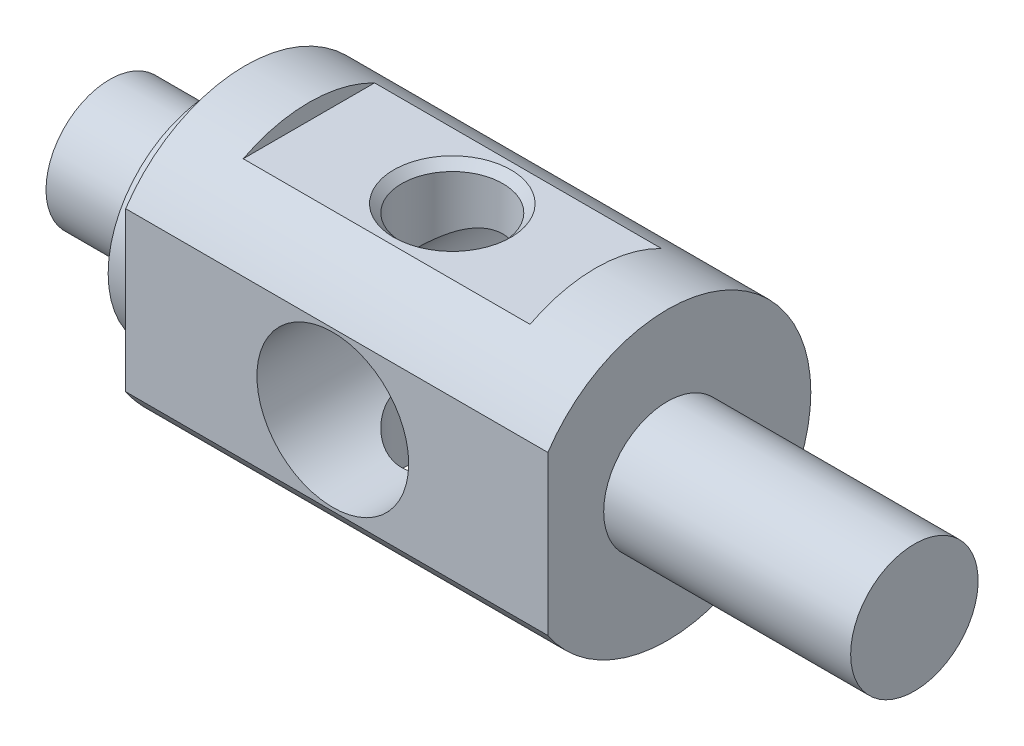
from build123d import *

# Parameters (mm, degrees)
SKETCH2_W                  = 30
SKETCH2_H                  = 12.7
CUT_EXTRUDE1_DEPTH         = 1.5
F_8_32_TAPPED_HOLE1_D      = 3.4544
F_8_32_TAPPED_HOLE1_DEPTH  = 10.71
F_8_32_TAPPED_HOLE1_TIP    = 1.037806461
SKETCH7_OUTSIDE_W          = 29.718
SKETCH7_OUTSIDE_H          = 31.218
SKETCH7_OUTSIDE_R          = 6.6
CUT_EXTRUDE2_DEPTH         = 2
F_3_8_0_3750_DOWEL_HOLE2_D = 9.525
CUT_EXTRUDE4_START         = 9
SKETCH11_W                 = 18
SKETCH11_H                 = 20
CUT_EXTRUDE4_DEPTH         = 1
F_1_4_0_2500_DOWEL_HOLE1_D = 6.35
CHAMFER1_SIZE              = 0.5


with BuildPart() as part:
    # Sketch1 → Revolve1 (revolve)
    with BuildSketch(Plane(origin=(0, 0, 0), x_dir=(1, 0, 0), z_dir=(0, 1, 0))):
        Polygon((-21.5, 0), (29, 0), (29, 4), (13.5, 4), (13.5, 9), (-15, 9), (-15, 4), (-21.5, 4), align=None)
    revolve(axis=Axis((-21.5, 0, 0), (1, 0, 0)))

    # Sketch2 → Cut-Extrude1 (cut)
    with BuildSketch(Plane.XY.offset(9)):
        Rectangle(SKETCH2_W, SKETCH2_H)
    extrude(amount=-CUT_EXTRUDE1_DEPTH, mode=Mode.SUBTRACT)

    # #8-32 Tapped Hole1
    with Locations(Plane.ZY.offset(21.5)):
        with Locations((0, 0)):
            Hole(F_8_32_TAPPED_HOLE1_D / 2, depth=F_8_32_TAPPED_HOLE1_DEPTH)
            with Locations((0, 0, -(F_8_32_TAPPED_HOLE1_DEPTH + F_8_32_TAPPED_HOLE1_TIP / 2))):  # 118° drill point
                Cone(0, F_8_32_TAPPED_HOLE1_D / 2, F_8_32_TAPPED_HOLE1_TIP, mode=Mode.SUBTRACT)

    # Sketch7 outside → Cut-Extrude2 (cut)
    with BuildSketch(Plane.ZY.offset(15)):
        with Locations((-0.75, 0)):
            Rectangle(SKETCH7_OUTSIDE_W, SKETCH7_OUTSIDE_H)
        Circle(SKETCH7_OUTSIDE_R, mode=Mode.SUBTRACT)
    extrude(amount=-CUT_EXTRUDE2_DEPTH, mode=Mode.SUBTRACT)

    # 3/8 (0.3750) Dowel Hole2 (through all)
    with Locations(Plane.XY.offset(7.5)):
        with Locations((0, 0)):
            Hole(F_3_8_0_3750_DOWEL_HOLE2_D / 2)

    # Sketch11 → Cut-Extrude4 (cut)
    with BuildSketch(Plane(origin=(0, 0, 0), x_dir=(1, 0, 0), z_dir=(0, 1, 0)).offset(CUT_EXTRUDE4_START)):
        Rectangle(SKETCH11_W, SKETCH11_H)
    cut_extrude4 = extrude(amount=-CUT_EXTRUDE4_DEPTH, mode=Mode.SUBTRACT)

    # 1/4 (0.2500) Dowel Hole1 (through all)
    with Locations(Plane(origin=(0, 8, 0), x_dir=(1, 0, 0), z_dir=(0, 1, 0))):
        with Locations((0, 0)):
            Hole(F_1_4_0_2500_DOWEL_HOLE1_D / 2)

    # Mirror1: Cut-Extrude4 across plane
    add(cut_extrude4.mirror(Plane.ZX), mode=Mode.SUBTRACT)

    # Chamfer1
    chamfer1_edges = [part.edges().sort_by_distance(p)[0] for p in [
        (3.175, 8, 0),
    ]]
    chamfer(chamfer1_edges, length=CHAMFER1_SIZE)


solid = part.part
